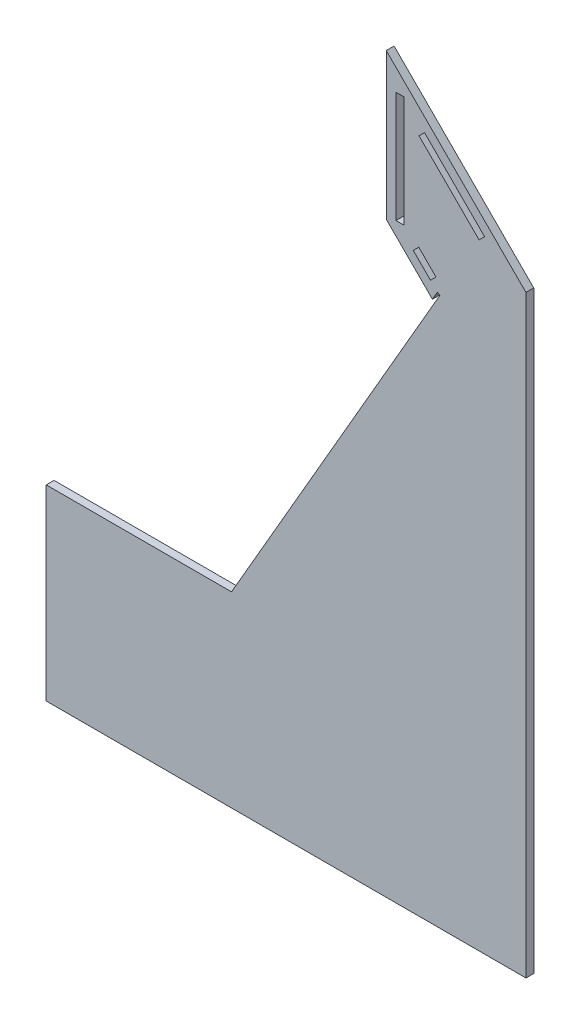
from build123d import *

# Parameters (mm, degrees)
SKETCH1_W           = 8
SKETCH1_H           = 113.93
BOSS_EXTRUDE1_DEPTH = 8


with BuildPart() as part:
    # Sketch1 → Boss-Extrude1 (new body)
    with BuildSketch(Plane.XY):
        Polygon((0, 192), (0, 0), (492, 0), (492, 608.949580676), (348.752525317, 752.197055359), (348.752525317, 602.197055359), (396.053847577, 554.895733099), (401.1547057, 563.73067853), (403.752781911, 562.23067853), (398.25, 552.699580676), (190, 192), align=None)
        with Locations((362.728298829, 663.122085401)):
            Rectangle(SKETCH1_W, SKETCH1_H, mode=Mode.SUBTRACT)
        Polygon((394.083637888, 570.801746342), (376.405968358, 588.479415871), (382.062822608, 594.136270121), (399.740492138, 576.458600591), align=None, mode=Mode.SUBTRACT)
        Polygon((443.916075063, 631.585600668), (382.284648015, 693.217027716), (387.941502264, 698.873881965), (449.572929313, 637.242454917), align=None, mode=Mode.SUBTRACT)
    extrude(amount=BOSS_EXTRUDE1_DEPTH)


solid = part.part
